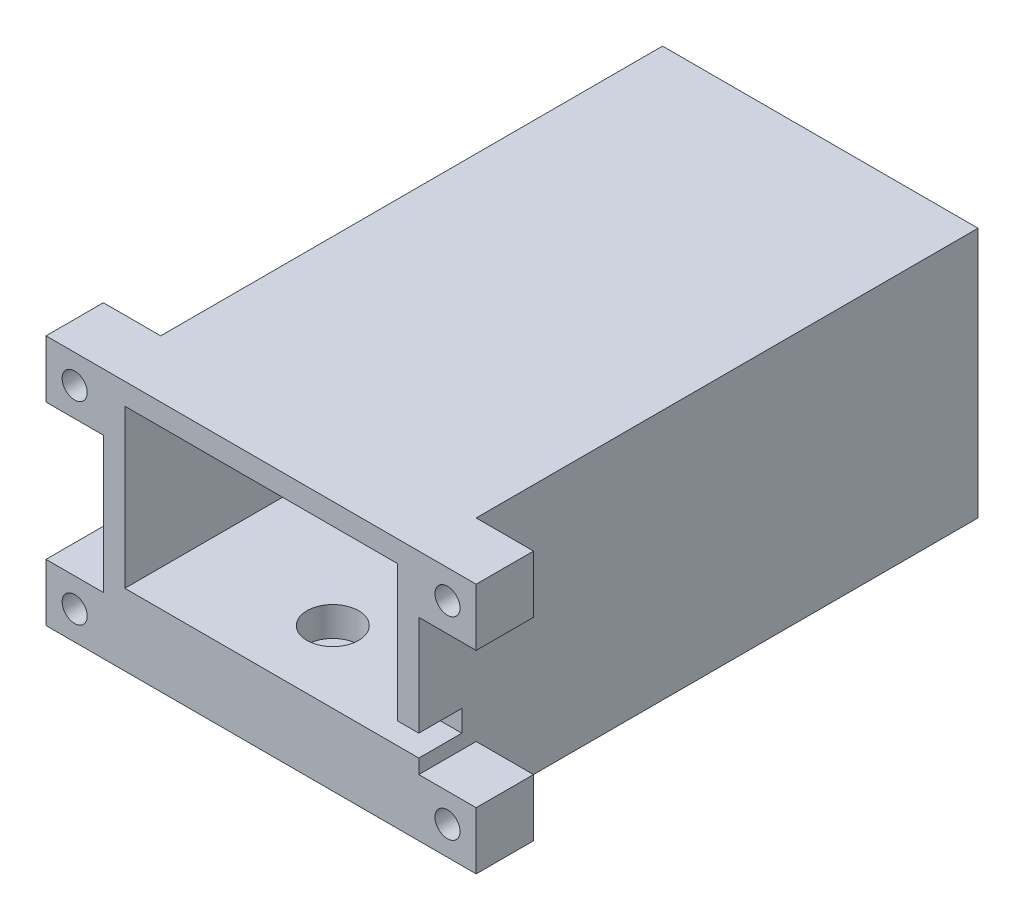
from build123d import *

# Parameters (mm, degrees)
SKETCH_1_W                 = 44
SKETCH_1_H                 = 78
EXTRUDE_1_DEPTH            = 35
SHELL_1_T                  = -3
SHELL_1_THICKNESS_2_FACE_W = 75
SHELL_1_THICKNESS_2_FACE_H = 38
SHELL_1_THICKNESS_2_DEPTH  = 7
SKETCH_3_R                 = 3.6
CUT_EXTRUDE_1_DEPTH        = 4.1
CUT_EXTRUDE_2_REACH        = 53.284
SKETCH_4_R                 = 2.25
SKETCH_5_W                 = 3
SKETCH_5_H                 = 3
CUT_EXTRUDE_3_DEPTH        = 6
SKETCH_6_W                 = 8
SKETCH_6_H                 = 8
SKETCH_6_R                 = 1.75
EXTRUDE_2_DEPTH            = 8
CUT_EXTRUDE_4_DEPTH        = 2.6


with BuildPart() as part:
    # 草圖1 → 填料-伸長1 (new body)
    with BuildSketch(Plane(origin=(0, 0, 0), x_dir=(1, 0, 0), z_dir=(0, 1, 0))):
        Rectangle(SKETCH_1_W, SKETCH_1_H)
    extrude(amount=EXTRUDE_1_DEPTH)

    # 薄殼1
    shell_1_openings = [part.faces().sort_by_distance(p)[0] for p in [
        (0, 17.5, 39),
    ]]
    offset(amount=SHELL_1_T, openings=shell_1_openings, kind=Kind.INTERSECTION)

    # 薄殼1 thickness 2 face (on inner face of the shell) → 薄殼1 thickness 2 (add)
    with BuildSketch(Plane(origin=(0, 3, 1.5), x_dir=(0, 0, -1), z_dir=(0, -1, 0))):
        Rectangle(SHELL_1_THICKNESS_2_FACE_W, SHELL_1_THICKNESS_2_FACE_H)
    extrude(amount=-SHELL_1_THICKNESS_2_DEPTH)

    # 草圖3 → 除料-伸長1 (cut)
    with BuildSketch(Plane(origin=(0, 10, 0), x_dir=(1, 0, 0), z_dir=(0, 1, 0))):
        with Locations((0, 25)):
            Circle(SKETCH_3_R)
        with Locations((0, -29)):
            Circle(SKETCH_3_R)
    extrude(amount=-CUT_EXTRUDE_1_DEPTH, mode=Mode.SUBTRACT)

    # 草圖4 → 除料-伸長2 (cut, up to next)
    with BuildSketch(Plane(origin=(0, 10, 0), x_dir=(1, 0, 0), z_dir=(0, 1, 0)), mode=Mode.PRIVATE) as cut_extrude_2_sk1:
        with Locations((0, 25)):
            Circle(SKETCH_4_R)
    cut_extrude_2_tool1 = extrude(cut_extrude_2_sk1.sketch, amount=-CUT_EXTRUDE_2_REACH, mode=Mode.PRIVATE) & part.part
    # 草圖4 → 除料-伸長2 (cut, up to next)
    with BuildSketch(Plane(origin=(0, 10, 0), x_dir=(1, 0, 0), z_dir=(0, 1, 0)), mode=Mode.PRIVATE) as cut_extrude_2_sk2:
        with Locations((0, -29)):
            Circle(SKETCH_4_R)
    cut_extrude_2_tool2 = extrude(cut_extrude_2_sk2.sketch, amount=-CUT_EXTRUDE_2_REACH, mode=Mode.PRIVATE) & part.part
    add(cut_extrude_2_tool1.solids().sort_by_distance((0, 10, -25))[0], mode=Mode.SUBTRACT)
    add(cut_extrude_2_tool2.solids().sort_by_distance((0, 10, 29))[0], mode=Mode.SUBTRACT)

    # 草圖5 → 除料-伸長3 (cut)
    with BuildSketch(Plane.XY.offset(39)):
        with Locations((20.5, 11.5)):
            Rectangle(SKETCH_5_W, SKETCH_5_H)
    extrude(amount=-CUT_EXTRUDE_3_DEPTH, mode=Mode.SUBTRACT)

    # 草圖6 → 填料-伸長2 (add)
    # profile 1 of 4: a face of its own
    with BuildSketch(Plane.XY.offset(39)):
        with Locations((-26, 31)):
            Rectangle(SKETCH_6_W, SKETCH_6_H)
        with Locations((-26, 31)):
            Circle(SKETCH_6_R, mode=Mode.SUBTRACT)
    # profile 2 of 4: a face of its own
    with BuildSketch(Plane.XY.offset(39)):
        with Locations((-26, 4)):
            Rectangle(SKETCH_6_W, SKETCH_6_H)
        with Locations((-26, 4)):
            Circle(SKETCH_6_R, mode=Mode.SUBTRACT)
    # profile 3 of 4: a face of its own
    with BuildSketch(Plane.XY.offset(39)):
        with Locations((26, 4)):
            Rectangle(SKETCH_6_W, SKETCH_6_H)
        with Locations((26, 4)):
            Circle(SKETCH_6_R, mode=Mode.SUBTRACT)
    # profile 4 of 4: a face of its own
    with BuildSketch(Plane.XY.offset(39)):
        with Locations((26, 31)):
            Rectangle(SKETCH_6_W, SKETCH_6_H)
        with Locations((26, 31)):
            Circle(SKETCH_6_R, mode=Mode.SUBTRACT)
    extrude(amount=-EXTRUDE_2_DEPTH)

    # 草圖7 → 除料-伸長4 (cut)
    with BuildSketch(Plane(origin=(0, 0, 31), x_dir=(-1, 0, 0), z_dir=(0, 0, -1))):
        Polygon((27.58771324, 6.75), (29.175426481, 4), (27.58771324, 1.25), (24.41228676, 1.25), (22.824573519, 4), (24.41228676, 6.75), align=None)
        Polygon((-22.824573519, 31), (-24.41228676, 33.75), (-27.58771324, 33.75), (-29.175426481, 31), (-27.58771324, 28.25), (-24.41228676, 28.25), align=None)
        Polygon((-29.175426481, 4), (-27.58771324, 1.25), (-24.41228676, 1.25), (-22.824573519, 4), (-24.41228676, 6.75), (-27.58771324, 6.75), align=None)
        Polygon((24.41228676, 28.25), (22.824573519, 31), (24.41228676, 33.75), (27.58771324, 33.75), (29.175426481, 31), (27.58771324, 28.25), align=None)
    extrude(amount=-CUT_EXTRUDE_4_DEPTH, mode=Mode.SUBTRACT)


solid = part.part
